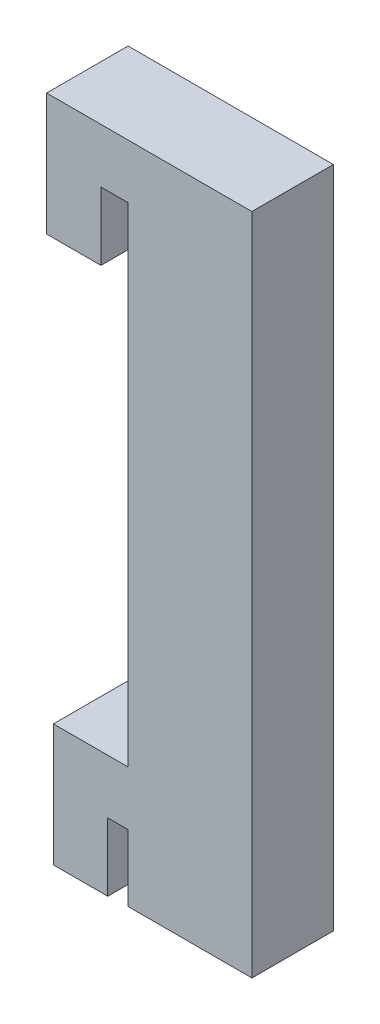
from build123d import *

# Parameters (mm, degrees)
BOSS_EXTRU_1_DEPTH = 6


with BuildPart() as part:
    # Esquisse1 → Boss.-Extru.1 (new body)
    with BuildSketch(Plane.XY):
        Polygon((0, 0), (0, 5), (1.5, 5), (1.5, 0.09638948), (10.621873618, 0.09638948), (10.621873618, 49), (-4.5, 49), (-4.5, 40), (-0.5, 40), (-0.5, 45), (1.5, 45), (1.5, 9), (-4, 9), (-4, 0), align=None)
    extrude(amount=BOSS_EXTRU_1_DEPTH)


solid = part.part
